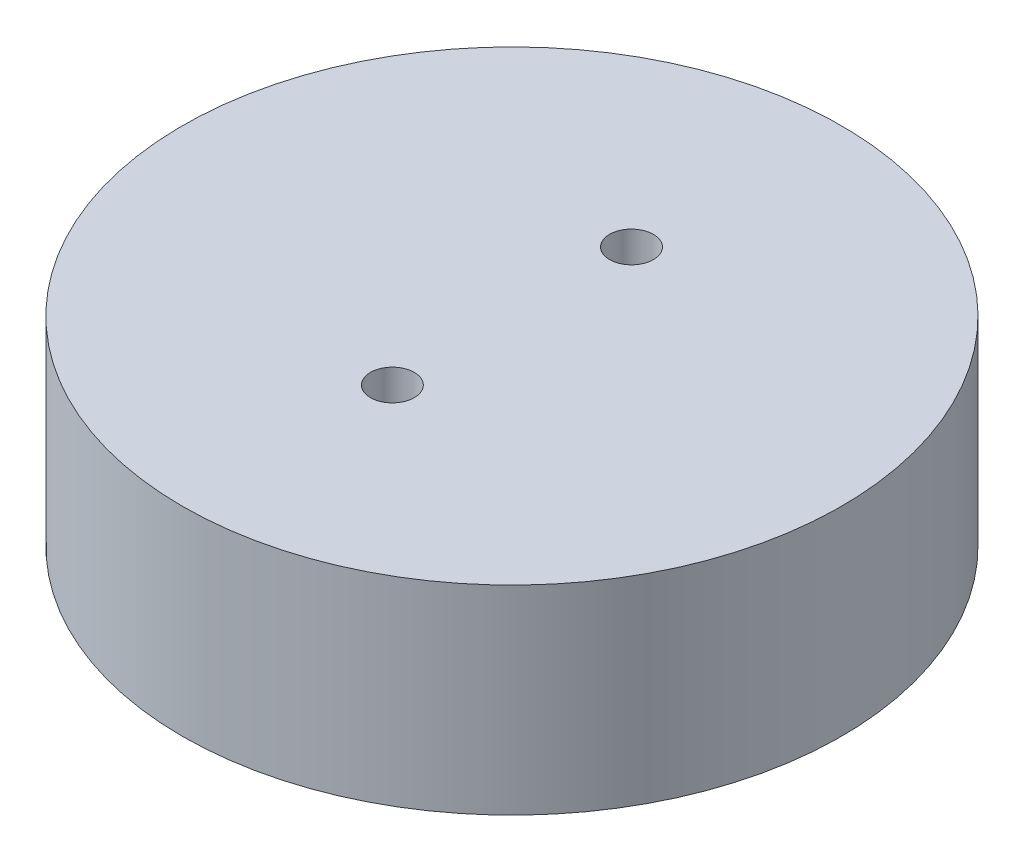
from build123d import *

# Parameters (mm, degrees)
SKETCH1_R           = 41.35
BOSS_EXTRUDE1_DEPTH = 25
SKETCH2_R           = 2.75
CUT_EXTRUDE1_DEPTH  = 25


with BuildPart() as part:
    # Sketch1 → Boss-Extrude1 (new body)
    with BuildSketch(Plane(origin=(0, 0, 0), x_dir=(1, 0, 0), z_dir=(0, 1, 0))):
        Circle(SKETCH1_R)
    extrude(amount=BOSS_EXTRUDE1_DEPTH)

    # Sketch2 → Cut-Extrude1 (cut)
    with BuildSketch(Plane(origin=(0, 25, 0), x_dir=(1, 0, 0), z_dir=(0, 1, 0))):
        with Locations((0, 15)):
            Circle(SKETCH2_R)
        with Locations((0, -15)):
            Circle(SKETCH2_R)
    extrude(amount=-CUT_EXTRUDE1_DEPTH, mode=Mode.SUBTRACT)


solid = part.part
